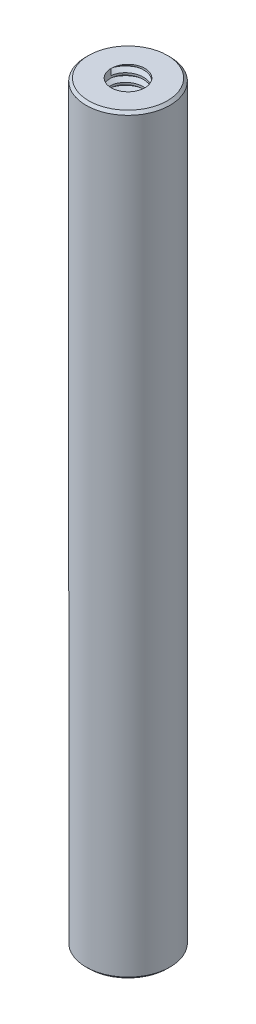
from build123d import *
from build123d.topology import SkipClean

# Parameters (mm, degrees)
CROQUIS2_R              = 6.35
SALIENTE_EXTRUIR1_DEPTH = 56.865650048
CHAFL_N1_SIZE           = 0.396875
TAP_START               = 56.86565
CROQUIS3_R              = 2.5527
TAP_HOLE_1_DEPTH        = 19.05
TAP_START_2             = -37.81565
CROQUIS3_2_R            = 2.5527
TAP_HOLE_2_DEPTH        = 19.05
ROSCA1_PITCH            = 1.27
ROSCA2_PITCH            = 1.27


with BuildPart() as part:
    # Croquis2 → Saliente-Extruir1 (new, symmetric)
    with BuildSketch(Plane(origin=(0, 0, 0), x_dir=(1, 0, 0), z_dir=(0, 1, 0))):
        with Locations(Location((0, 0, 0), (0, 0, 90))):
            Circle(CROQUIS2_R)
    extrude(amount=SALIENTE_EXTRUIR1_DEPTH, both=True)

    # Chaflán1
    chafl_n1_edges = [part.edges().sort_by_distance(p)[0] for p in [
        (0, -56.865650048, 6.35),
        (0, 56.865650048, 6.35),
    ]]
    chamfer(chafl_n1_edges, length=CHAFL_N1_SIZE)

    # Croquis3 → Tap Hole 1 (cut)
    with BuildSketch(Plane(origin=(0, 0, 0), x_dir=(1, 0, 0), z_dir=(0, 1, 0)).offset(TAP_START)):
        with Locations(Location((0, 0, 0), (0, 0, 270))):
            Circle(CROQUIS3_R)
    extrude(amount=-TAP_HOLE_1_DEPTH, mode=Mode.SUBTRACT)

    # Croquis3<2> → Tap Hole 2 (cut)
    with BuildSketch(Plane(origin=(0, 0, 0), x_dir=(1, 0, 0), z_dir=(0, 1, 0)).offset(TAP_START_2)):
        with Locations(Location((0, 0, 0), (0, 0, 270))):
            Circle(CROQUIS3_2_R)
    extrude(amount=-TAP_HOLE_2_DEPTH, mode=Mode.SUBTRACT)

    # Rosca1: the profile of Perfil de rosca1 profile screwed along a right-hand helix of 15 turns, 8 arcs to a turn; built about Z, then put on its axis
    with SkipClean():  # the faces are left unmerged after this step: merging them gives an invalid solid
        rosca1_z = Axis((0, 0, 0), (0, 0, 1))
        rosca1_corners = [(2.5524, 0, -0.000173205), (3.240107661, 0, 0.396874998), (3.240107661, 0, 0.555624998), (2.5524, 0, 0.952673202)]
        with BuildLine(mode=Mode.PRIVATE) as rosca1_profile:
            Line(rosca1_corners[0], rosca1_corners[1])
            Line(rosca1_corners[1], rosca1_corners[2])
            Line(rosca1_corners[2], rosca1_corners[3])
            Line(rosca1_corners[3], rosca1_corners[0])
        rosca1_cap = Face(rosca1_profile.wire())
        rosca1_turn_angles = [0, 22.5, 45, 67.5, 90, 112.5, 135, 157.5, 180, 202.5, 225, 247.5, 270, 292.5, 315, 337.5, 360]
        rosca1_turn_weights = [1, 0.9238795325112867, 1, 0.9238795325112867, 1, 0.9238795325112867, 1, 0.9238795325112867, 1, 0.9238795325112867, 1, 0.9238795325112867, 1, 0.9238795325112867, 1, 0.9238795325112867, 1]
        rosca1_turn_rails = [Edge.make_bspline([Vector(p[0], p[1], 0).rotate(rosca1_z, rosca1_turn_angles[k]) / rosca1_turn_weights[k] + Vector(0, 0, p[2] + ROSCA1_PITCH * rosca1_turn_angles[k] / 360) for k in range(17)], [0, 0, 0, 1, 1, 2, 2, 3, 3, 4, 4, 5, 5, 6, 6, 7, 7, 8, 8, 8], 2, rosca1_turn_weights) for p in rosca1_corners]
        rosca1_turn_sides = [Face.make_surface_from_curves(rosca1_turn_rails[p[0]], rosca1_turn_rails[p[1]]) for p in [(0, 1), (1, 2), (2, 3), (3, 0)]]
        rosca1 = Plane(origin=(0, 56.865650048, 0), x_dir=(-1, 0, 0), z_dir=(0, -1, 0)) * Solid(Shell([*[p.moved(Location((0, 0, ROSCA1_PITCH * i))) for i in range(15) for p in rosca1_turn_sides], rosca1_cap, rosca1_cap.rotate(rosca1_z, 5400).moved(Location((0, 0, ROSCA1_PITCH * 5400 / 360)))]))
        add(rosca1, mode=Mode.SUBTRACT)

    # Rosca2: the profile of Perfil de rosca2 profile screwed along a right-hand helix of 15 turns, 8 arcs to a turn; built about Z, then put on its axis
    with SkipClean():  # the faces are left unmerged after this step: merging them gives an invalid solid
        rosca2_z = Axis((0, 0, 0), (0, 0, 1))
        rosca2_corners = [(2.5524, 0, -0.000173205), (3.240107661, 0, 0.396874998), (3.240107661, 0, 0.555624998), (2.5524, 0, 0.952673202)]
        with BuildLine(mode=Mode.PRIVATE) as rosca2_profile:
            Line(rosca2_corners[0], rosca2_corners[1])
            Line(rosca2_corners[1], rosca2_corners[2])
            Line(rosca2_corners[2], rosca2_corners[3])
            Line(rosca2_corners[3], rosca2_corners[0])
        rosca2_cap = Face(rosca2_profile.wire())
        rosca2_turn_angles = [0, 22.5, 45, 67.5, 90, 112.5, 135, 157.5, 180, 202.5, 225, 247.5, 270, 292.5, 315, 337.5, 360]
        rosca2_turn_weights = [1, 0.9238795325112867, 1, 0.9238795325112867, 1, 0.9238795325112867, 1, 0.9238795325112867, 1, 0.9238795325112867, 1, 0.9238795325112867, 1, 0.9238795325112867, 1, 0.9238795325112867, 1]
        rosca2_turn_rails = [Edge.make_bspline([Vector(p[0], p[1], 0).rotate(rosca2_z, rosca2_turn_angles[k]) / rosca2_turn_weights[k] + Vector(0, 0, p[2] + ROSCA2_PITCH * rosca2_turn_angles[k] / 360) for k in range(17)], [0, 0, 0, 1, 1, 2, 2, 3, 3, 4, 4, 5, 5, 6, 6, 7, 7, 8, 8, 8], 2, rosca2_turn_weights) for p in rosca2_corners]
        rosca2_turn_sides = [Face.make_surface_from_curves(rosca2_turn_rails[p[0]], rosca2_turn_rails[p[1]]) for p in [(0, 1), (1, 2), (2, 3), (3, 0)]]
        rosca2 = Plane(origin=(0, -56.865650048, 0), x_dir=(1, 0, 0), z_dir=(0, 1, 0)) * Solid(Shell([*[p.moved(Location((0, 0, ROSCA2_PITCH * i))) for i in range(15) for p in rosca2_turn_sides], rosca2_cap, rosca2_cap.rotate(rosca2_z, 5400).moved(Location((0, 0, ROSCA2_PITCH * 5400 / 360)))]))
        add(rosca2, mode=Mode.SUBTRACT)


solid = part.part
